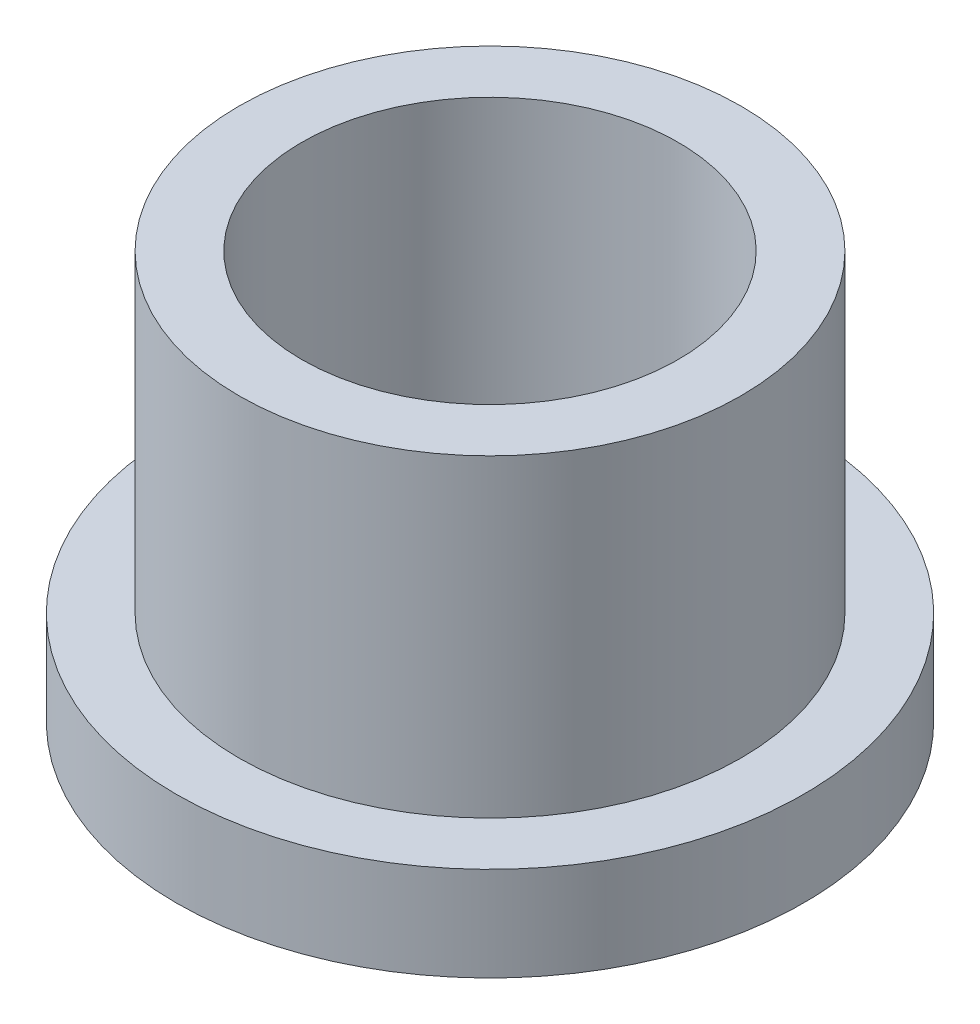
from build123d import *

# Parameters (mm, degrees)
SKETCH2_R           = 5
BOSS_EXTRUDE1_DEPTH = 1.5
SKETCH3_R           = 4
BOSS_EXTRUDE2_DEPTH = 6.5
SKETCH4_R           = 3
CUT_EXTRUDE1_DEPTH  = 10.604686356


with BuildPart() as part:
    # Sketch2 → Boss-Extrude1 (new body)
    with BuildSketch(Plane(origin=(0, 0, 0), x_dir=(1, 0, 0), z_dir=(0, 1, 0))):
        Circle(SKETCH2_R)
    extrude(amount=BOSS_EXTRUDE1_DEPTH)

    # Sketch3 → Boss-Extrude2 (add)
    with BuildSketch(Plane.XZ):
        Circle(SKETCH3_R)
    extrude(amount=-BOSS_EXTRUDE2_DEPTH)

    # Sketch4 → Cut-Extrude1 (cut, through all)
    with BuildSketch(Plane(origin=(0, 6.5, 0), x_dir=(1, 0, 0), z_dir=(0, 1, 0))):
        Circle(SKETCH4_R)
    extrude(amount=-CUT_EXTRUDE1_DEPTH, mode=Mode.SUBTRACT)


solid = part.part
